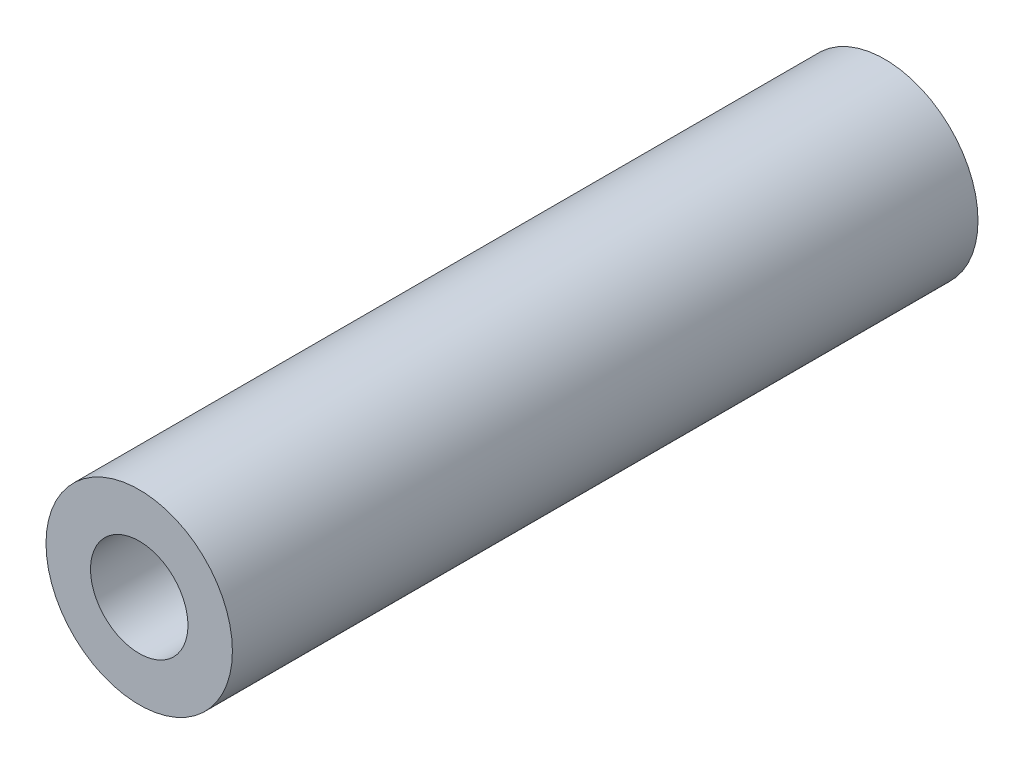
from build123d import *

# Parameters (mm, degrees)
SKETCH1_R           = 4.7625
SKETCH1_R_2         = 2.4892
BOSS_EXTRUDE1_DEPTH = 38.1


with BuildPart() as part:
    # Sketch1 → Boss-Extrude1 (new body)
    with BuildSketch(Plane.XY):
        Circle(SKETCH1_R)
        Circle(SKETCH1_R_2, mode=Mode.SUBTRACT)
    extrude(amount=BOSS_EXTRUDE1_DEPTH)


solid = part.part
